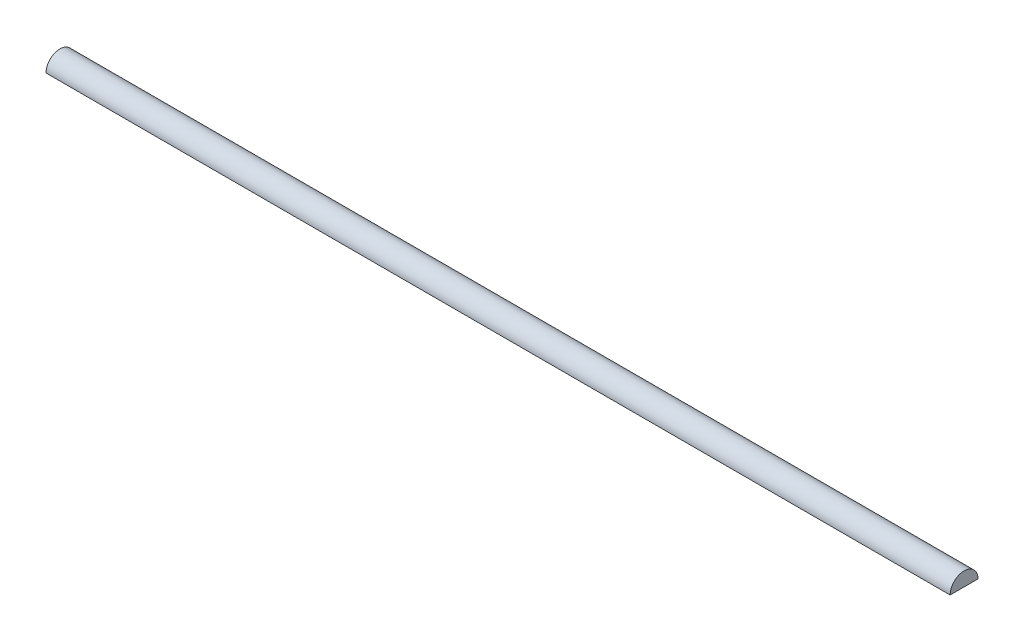
from build123d import *

# Parameters (mm, degrees)
BOSS_EXTRUDE1_DEPTH      = 40000
BOSS_EXTRUDE1_DEPTH_BACK = 40000
SKETCH2_R                = 1232.857562003
SKETCH3_W                = 80000
SKETCH3_H                = 3639.943339499
CUT_EXTRUDE1_DEPTH       = 40038.980412808


with BuildPart() as part:
    # Sketch1 → Revolve1 (revolve)
    with BuildSketch(Plane(origin=(0, 0, 0), x_dir=(-1, 0, 0), z_dir=(0, 1, 0))):
        Polygon((2034.243237694, 337.92), (227.58296711, 983.35), (5509.823784071, 1120), (10030.825662186, 1120), (10227.58296711, 1070), (8763.003370024, 1070), (8763.003370024, 0), (3247.519684342, 0), (3247.519684342, 368.69), align=None)
    revolve(axis=Axis((-3247.519684342, 0, 0), (-1, 0, 0)))


with BuildPart() as body_2:
    # Sketch2 → Boss-Extrude1 (new, two sides: drawn at the far end of the back side and taken through both)
    with BuildSketch(Plane(origin=(0, 0, 0), x_dir=(0, 0, -1), z_dir=(1, 0, 0)).offset(-BOSS_EXTRUDE1_DEPTH_BACK)):
        Circle(SKETCH2_R)
    extrude(amount=BOSS_EXTRUDE1_DEPTH + BOSS_EXTRUDE1_DEPTH_BACK)

    # Combine1: cut part
    add(part.part, mode=Mode.SUBTRACT)

    # Sketch3 → Cut-Extrude1 (cut, through all)
    with BuildSketch(Plane(origin=(0, 0, 0), x_dir=(-1, 0, 0), z_dir=(0, 1, 0))):
        with Locations((0, 260.380744392)):
            Rectangle(SKETCH3_W, SKETCH3_H)
    extrude(amount=-CUT_EXTRUDE1_DEPTH, mode=Mode.SUBTRACT)


solid = body_2.part
